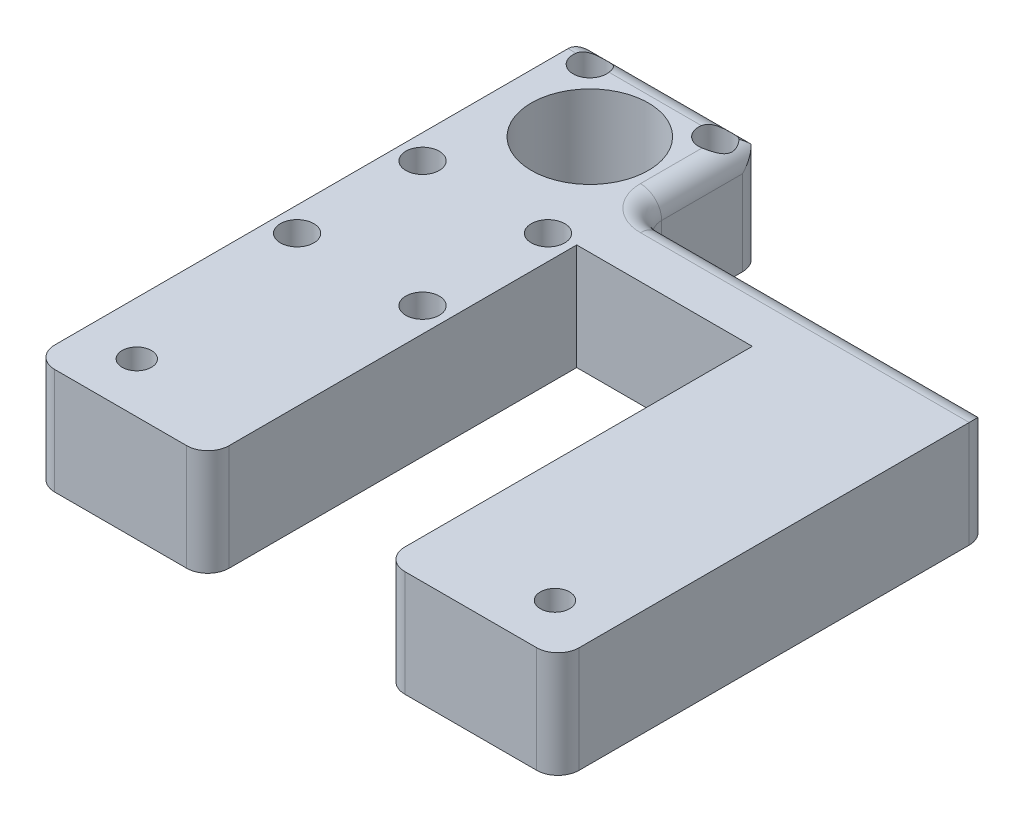
from build123d import *

# Parameters (mm, degrees)
SKETCH1_R           = 1.75
BOSS_EXTRUDE1_DEPTH = 6.35
SKETCH5_W           = 20.85
SKETCH5_H           = 14.732
BOSS_EXTRUDE2_DEPTH = 12.7
SKETCH2_R           = 1.125
CUT_EXTRUDE1_DEPTH  = 53.837699391
SKETCH3_R           = 2
CUT_EXTRUDE2_DEPTH  = 11.2
FILLET1_R           = 2.54
FILLET2_R           = 2.54
SKETCH6_R           = 7
CUT_EXTRUDE3_DEPTH  = 53.837699527


with BuildPart() as part:
    # Sketch1 → Boss-Extrude1 (new, symmetric)
    with BuildSketch(Plane(origin=(0, 0, 0), x_dir=(1, 0, 0), z_dir=(0, 1, 0))):
        Polygon((-31.35, -25.859994), (-31.35, 25.859994), (31.35, 25.859994), (31.35, -25.859994), (10.5, -25.859994), (10.5, 18.239994), (-10.5, 18.239994), (-10.5, -25.859994), align=None)
        with Locations(Location((-25, -19.860006, 0), (0, 0, 270))):
            Circle(SKETCH1_R, mode=Mode.SUBTRACT)
        with Locations(Location((25, -19.860006, 0), (0, 0, 270))):
            Circle(SKETCH1_R, mode=Mode.SUBTRACT)
    extrude(amount=BOSS_EXTRUDE1_DEPTH, both=True)

    # Sketch5 → Boss-Extrude2 (add, through all)
    with BuildSketch(Plane.XZ.offset(6.35)):
        with Locations((-20.925, -33.225994)):
            Rectangle(SKETCH5_W, SKETCH5_H)
    extrude(amount=-BOSS_EXTRUDE2_DEPTH)

    # Sketch2 → Cut-Extrude1 (cut, through all)
    with BuildSketch(Plane(origin=(0, 6.35, 0), x_dir=(1, 0, 0), z_dir=(0, 1, 0))):
        with Locations(Location((-28.425, 17.731994, 0), (0, 0, 270))):
            Circle(SKETCH2_R)
        with Locations(Location((-13.425, 17.731994, 0), (0, 0, 270))):
            Circle(SKETCH2_R)
        with Locations(Location((-13.425, 2.731994, 0), (0, 0, 270))):
            Circle(SKETCH2_R)
        with Locations(Location((-28.425, 2.731994, 0), (0, 0, 270))):
            Circle(SKETCH2_R)
        with Locations(Location((-13.425, 37.731994, 0), (0, 0, 270))):
            Circle(SKETCH2_R)
        with Locations(Location((-28.425, 37.731994, 0), (0, 0, 270))):
            Circle(SKETCH2_R)
    extrude(amount=-CUT_EXTRUDE1_DEPTH, mode=Mode.SUBTRACT)

    # Sketch3 → Cut-Extrude2 (cut)
    with BuildSketch(Plane(origin=(0, 6.35, 0), x_dir=(1, 0, 0), z_dir=(0, 1, 0))):
        with Locations(Location((-28.425, 17.731994, 0), (0, 0, 270))):
            Circle(SKETCH3_R)
        with Locations(Location((-13.425, 17.731994, 0), (0, 0, 270))):
            Circle(SKETCH3_R)
        with Locations(Location((-13.425, 2.731994, 0), (0, 0, 270))):
            Circle(SKETCH3_R)
        with Locations(Location((-28.425, 2.731994, 0), (0, 0, 270))):
            Circle(SKETCH3_R)
        with Locations(Location((-28.425, 37.731994, 0), (0, 0, 270))):
            Circle(SKETCH3_R)
        with Locations(Location((-13.425, 37.731994, 0), (0, 0, 270))):
            Circle(SKETCH3_R)
    extrude(amount=-CUT_EXTRUDE2_DEPTH, mode=Mode.SUBTRACT)

    # Fillet1
    # the kernel refuses this fillet: 2.54 mm, written as the material it adds along each edge
    with BuildSketch(Plane(origin=(-10.5, -6.35, -25.859994), x_dir=(0, 0, -1), z_dir=(0, 1, 0))) as fillet1_piece_1:
        with BuildLine():
            CenterArc((FILLET1_R, -FILLET1_R), FILLET1_R, 90, 90)
            Line((0, -FILLET1_R), (0, 0))
            Line((0, 0), (FILLET1_R, 0))
        make_face()
    extrude(amount=12.7)
    # the kernel refuses this fillet: 2.54 mm, written as the material it takes off along each edge
    with BuildSketch(Plane(origin=(-31.35, -12.7, 25.859994), x_dir=(0, 0, -1), z_dir=(0, 1, 0)), Plane(origin=(31.35, 12.7, -25.859994), x_dir=(-1, 0, 0), z_dir=(0, -1, 0)), Plane(origin=(31.35, 12.7, 25.859994), x_dir=(0, 0, -1), z_dir=(0, -1, 0)), Plane(origin=(-10.5, -12.7, 25.859994), x_dir=(-1, 0, 0), z_dir=(0, 1, 0))) as fillet1_2_piece_1:
        with BuildLine():
            CenterArc((FILLET1_R, -FILLET1_R), FILLET1_R, 90, 90)
            Line((0, -FILLET1_R), (0, 0))
            Line((0, 0), (FILLET1_R, 0))
        make_face()
    extrude(amount=25.4, mode=Mode.SUBTRACT)
    with BuildSketch(Plane(origin=(10.5, 12.7, 25.859994), x_dir=(0, 0, -1), z_dir=(0, -1, 0)), Plane(origin=(-31.35, -12.7, -40.591994), x_dir=(0, 0, 1), z_dir=(0, 1, 0)), Plane(origin=(-10.5, -12.7, -40.591994), x_dir=(-1, 0, 0), z_dir=(0, 1, 0))) as fillet1_2_piece_2:
        with BuildLine():
            CenterArc((FILLET1_R, FILLET1_R), FILLET1_R, 180, 90)
            Line((0, FILLET1_R), (0, 0))
            Line((0, 0), (FILLET1_R, 0))
        make_face()
    extrude(amount=25.4, mode=Mode.SUBTRACT)
    with BuildSketch(Plane(origin=(-7.96, 6.35, -25.859994), x_dir=(0, 0, 1), z_dir=(1, 0, 0))) as fillet1_2_piece_3:
        with BuildLine():
            CenterArc((FILLET1_R, FILLET1_R), FILLET1_R, 180, 90)
            Line((0, FILLET1_R), (0, 0))
            Line((0, 0), (FILLET1_R, 0))
        make_face()
    extrude(amount=45.66, mode=Mode.SUBTRACT)
    with BuildSketch(Plane(origin=(-10.5, 6.35, -28.399994), x_dir=(-1, 0, 0), z_dir=(0, 0, -1))) as fillet1_2_piece_4:
        with BuildLine():
            CenterArc((FILLET1_R, -FILLET1_R), FILLET1_R, 90, 90)
            Line((0, -FILLET1_R), (0, 0))
            Line((0, 0), (FILLET1_R, 0))
        make_face()
    extrude(amount=18.542, mode=Mode.SUBTRACT)
    with BuildSketch(Plane(origin=(-7.96, 6.35, -28.399994), x_dir=(-1, 0, 0), z_dir=(0, 0, -1))) as fillet1_2_piece_5:
        with BuildLine():
            CenterArc((2.54 + FILLET1_R, -FILLET1_R), FILLET1_R, 90, 90)
            Line((2.54, -FILLET1_R), (2.54, 0))
            Line((2.54, 0), (2.54 + FILLET1_R, 0))
        make_face()
    revolve(axis=Axis((-7.96, 6.35, -28.399994), (0, 1, 0)), revolution_arc=90, mode=Mode.SUBTRACT)

    # Fillet2
    # the kernel refuses this fillet: 2.54 mm, written as the material it takes off along each edge
    with BuildSketch(Plane(origin=(-6.69, 6.35, -40.591994), x_dir=(0, -1, 0), z_dir=(-1, 0, 0))) as fillet2_piece_1:
        with BuildLine():
            CenterArc((FILLET2_R, FILLET2_R), FILLET2_R, 180, 90)
            Line((0, FILLET2_R), (0, 0))
            Line((0, 0), (FILLET2_R, 0))
        make_face()
    extrude(amount=28.47, mode=Mode.SUBTRACT)

    # Sketch6 → Cut-Extrude3 (cut, through all)
    with BuildSketch(Plane(origin=(0, 6.35, 0), x_dir=(1, 0, 0), z_dir=(0, 1, 0))):
        with Locations(Location((-20.925, 30.231994, 0), (0, 0, 270))):
            Circle(SKETCH6_R)
    extrude(amount=-CUT_EXTRUDE3_DEPTH, mode=Mode.SUBTRACT)


solid = part.part
